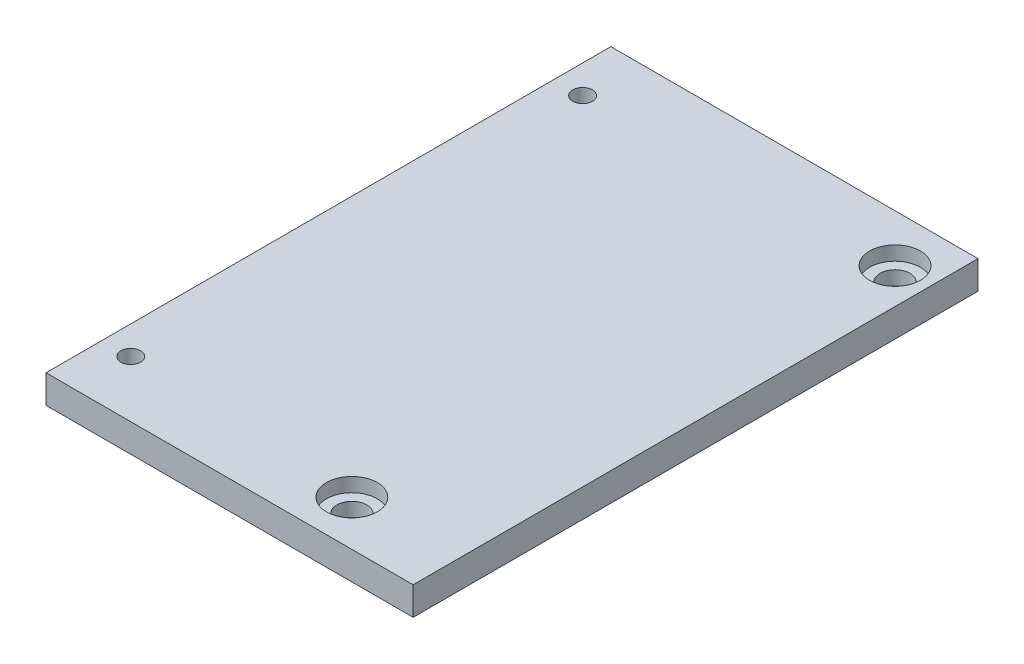
from build123d import *

# Parameters (mm, degrees)
SKETCH2_W           = 65
SKETCH2_H           = 100
SKETCH2_R           = 1.75
SKETCH2_R_2         = 2.65
BOSS_EXTRUDE1_DEPTH = 5
SKETCH3_R           = 4.5
CUT_EXTRUDE1_DEPTH  = 2.5


with BuildPart() as part:
    # Sketch2 → Boss-Extrude1 (new body)
    with BuildSketch(Plane(origin=(0, 0, 0), x_dir=(1, 0, 0), z_dir=(0, 1, 0))):
        Rectangle(SKETCH2_W, SKETCH2_H)
        with Locations((-27.5, 40)):
            Circle(SKETCH2_R, mode=Mode.SUBTRACT)
        with Locations((-27.5, -40)):
            Circle(SKETCH2_R, mode=Mode.SUBTRACT)
        with Locations((26.23, 41.58)):
            Circle(SKETCH2_R_2, mode=Mode.SUBTRACT)
        with Locations((13.65, -42)):
            Circle(SKETCH2_R_2, mode=Mode.SUBTRACT)
    extrude(amount=BOSS_EXTRUDE1_DEPTH)

    # Sketch3 → Cut-Extrude1 (cut)
    with BuildSketch(Plane(origin=(0, 5, 0), x_dir=(1, 0, 0), z_dir=(0, 1, 0))):
        with Locations((26.23, 41.58)):
            Circle(SKETCH3_R)
        with Locations((13.65, -42)):
            Circle(SKETCH3_R)
    extrude(amount=-CUT_EXTRUDE1_DEPTH, mode=Mode.SUBTRACT)


solid = part.part
